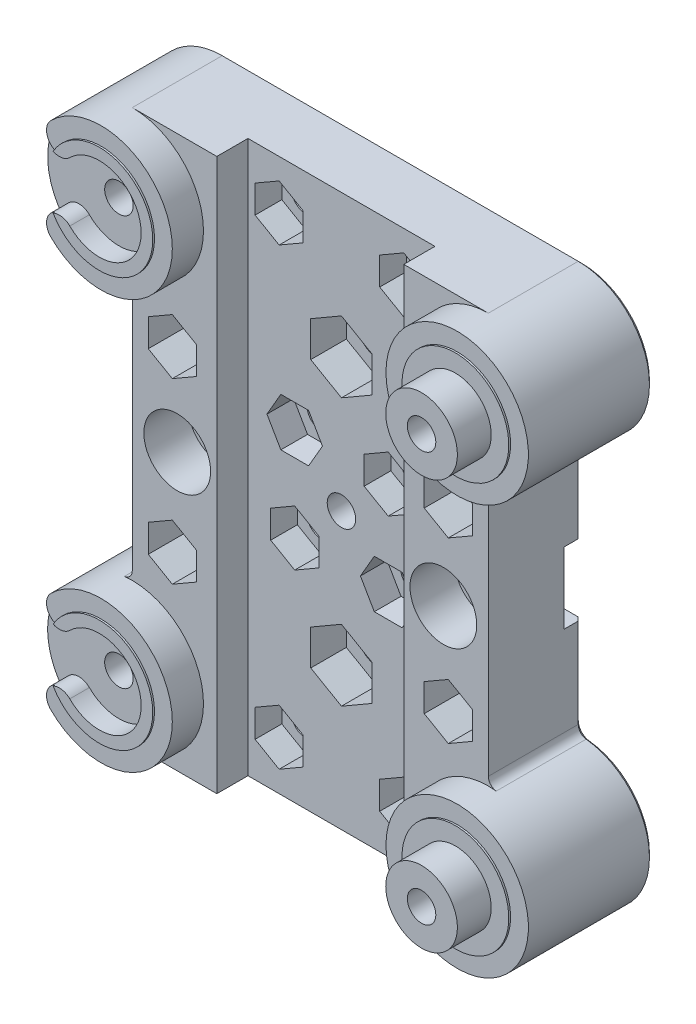
from build123d import *

# Parameters (mm, degrees)
SKETCH_2_W                  = 40
SKETCH_2_H                  = 62
EXTRUDE_1_DEPTH             = 10.5
EXTRUDE_2_DEPTH             = 10.5
CUT_EXTRUDE_1_DEPTH         = 5
SKETCH_29_R                 = 8
EXTRUDE_5_DEPTH             = 3.5
SKETCH_7_R                  = 4.025
EXTRUDE_3_DEPTH             = 9
SKETCH_8_R                  = 1.6
CUT_EXTRUDE_2_DEPTH         = 48.68647607
SKETCH_12_R                 = 6
SKETCH_12_R_2               = 4.025
EXTRUDE_4_DEPTH             = 0.2
SKETCH_13_R                 = 1.6
CUT_EXTRUDE_5_DEPTH         = 48.68647607
MIRROR_4_COPY_1_SKETCH_R    = 1.6
MIRROR_4_COPY_1_DEPTH       = 48.68647607
SKETCH_14_R                 = 2.05
CUT_EXTRUDE_6_DEPTH         = 48.68647607
SKETCH_15_R                 = 1.6
CUT_EXTRUDE_7_DEPTH         = 48.68647607
CUT_EXTRUDE_8_DEPTH         = 48.68647607
CUT_EXTRUDE_8_DEPTH_BACK    = 48.68647607
SKETCH_16_R                 = 1.6
PATTERN_CIRCULAR_1_COUNT    = 4
CUT_EXTRUDE_START           = -5
CUT_EXTRUDE_9_DEPTH         = 49.603325561
SKETCH_19_R                 = 3.75
CUT_EXTRUDE_11_DEPTH        = 5
SKETCH_18_W                 = 21
SKETCH_18_H                 = 62
CUT_EXTRUDE_10_DEPTH        = 3.5
MIRROR_7_COPY_1_SKETCH_R    = 1.6
MIRROR_7_COPY_1_DEPTH       = 48.68647607
MIRROR_7_COPY_2_SKETCH_R    = 1.6
MIRROR_7_COPY_2_DEPTH       = 48.68647607
MIRROR_7_COPY_3_SKETCH_R    = 1.6
MIRROR_7_COPY_3_DEPTH       = 48.68647607
MIRROR_7_COPY_4_SKETCH_R    = 2.05
MIRROR_7_COPY_4_DEPTH       = 48.68647607
MIRROR_7_COPY_5_DEPTH       = 10.5
MIRROR_7_COPY_6_DEPTH       = 5
MIRROR_7_COPY_7_SKETCH_R    = 8
MIRROR_7_COPY_7_DEPTH       = 3.5
MIRROR_7_COPY_8_SKETCH_R    = 4.025
MIRROR_7_COPY_8_DEPTH       = 9
MIRROR_7_COPY_9_SKETCH_R    = 1.6
MIRROR_7_COPY_9_DEPTH       = 48.68647607
MIRROR_7_COPY_10_SKETCH_R   = 6
MIRROR_7_COPY_10_SKETCH_R_2 = 4.025
MIRROR_7_COPY_10_DEPTH      = 0.2
MIRROR_START                = -5
MIRROR_7_COPY_11_DEPTH      = 49.603325561
CUT_EXTRUDE_12_DEPTH        = 3
PATTERN_CIRCULAR_2_COUNT    = 4
CUT_EXTRUDE_13_DEPTH        = 3
SKETCH_22_R                 = 1.6
CUT_EXTRUDE_14_DEPTH        = 46.891175622
SKETCH_23_R                 = 2.1
CUT_EXTRUDE_15_DEPTH        = 45.732538493
CUT_EXTRUDE_16_DEPTH        = 4
MIRROR_9_COPY_1_DEPTH       = 3
MIRROR_9_COPY_2_SKETCH_R    = 1.6
MIRROR_9_COPY_2_DEPTH       = 46.891175622
SKETCH_25_R                 = 4.025
CUT_EXTRUDE_17_DEPTH        = 5
SKETCH_26_R                 = 4.7
CUT_EXTRUDE_18_DEPTH        = 11
CUT_EXTRUDE_19_DEPTH        = 44.462627624
FILLET_1_R                  = 1
SKETCH_31_W                 = 3.2
SKETCH_31_H                 = 1.2
EXTRUDE_6_DEPTH             = 0.2
EXTRUDE_7_DEPTH             = 0.4
MIRROR_15_COPY_1_SKETCH_W   = 3.2
MIRROR_15_COPY_1_SKETCH_H   = 1.2
MIRROR_15_COPY_1_DEPTH      = 0.2
MIRROR_15_COPY_2_DEPTH      = 0.4
CUT_EXTRUDE_22_DEPTH        = 4
CHAMFER_1_SIZE              = 0.4
CHAMFER_2_SIZE              = 0.4
CHAMFER_3_SIZE              = 0.4
SKETCH_33_W                 = 3.25
SKETCH_33_H                 = 1
CUT_EXTRUDE_23_DEPTH        = 1
PATTERN_LINEAR_1_COUNT      = 5
PATTERN_LINEAR_1_PITCH      = 2
MIRROR_17_COPY_1_SKETCH_W   = 3.25
MIRROR_17_COPY_1_SKETCH_H   = 1
MIRROR_17_COPY_1_DEPTH      = 1
MIRROR_17_COPY_2_SKETCH_W   = 3.25
MIRROR_17_COPY_2_SKETCH_H   = 1
MIRROR_17_COPY_2_DEPTH      = 1
MIRROR_17_COPY_3_SKETCH_W   = 3.25
MIRROR_17_COPY_3_SKETCH_H   = 1
MIRROR_17_COPY_3_DEPTH      = 1
MIRROR_17_COPY_4_SKETCH_W   = 3.25
MIRROR_17_COPY_4_SKETCH_H   = 1
MIRROR_17_COPY_4_DEPTH      = 1


with BuildPart() as part:
    # 草图2 → 凸台-拉伸1 (new body)
    with BuildSketch(Plane.XY):
        Rectangle(SKETCH_2_W, SKETCH_2_H)
    extrude(amount=EXTRUDE_1_DEPTH)

    # 草图3 → 凸台-拉伸2 (add)
    with BuildSketch(Plane(origin=(0, 0, 0), x_dir=(-1, 0, 0), z_dir=(0, 0, -1))):
        with BuildLine():
            Line((20, 31), (20, 15))
            ThreePointArc((20, 15), (28, 23), (20, 31))
        make_face()
    extrude_2 = extrude(amount=-EXTRUDE_2_DEPTH)

    # 草图5 → 切除-拉伸1 (cut)
    with BuildSketch(Plane(origin=(0, 0, 0), x_dir=(-1, 0, 0), z_dir=(0, 0, -1))):
        Polygon((21.616580754, 25.8), (18.383419246, 25.8), (16.766838493, 23), (18.383419246, 20.2), (21.616580754, 20.2), (23.233161507, 23), align=None)
    cut_extrude_1 = extrude(amount=-CUT_EXTRUDE_1_DEPTH, mode=Mode.SUBTRACT)

    # 草图29 → 凸台-拉伸5 (add)
    with BuildSketch(Plane.XY.offset(10.5)):
        with Locations(Location((-20, 23, 0), (0, 0, 270))):
            Circle(SKETCH_29_R)
    extrude_5 = extrude(amount=EXTRUDE_5_DEPTH)

    # 草图7 → 凸台-拉伸3 (add)
    with BuildSketch(Plane.XY.offset(14)):
        with Locations((-20, 23)):
            Circle(SKETCH_7_R)
    extrude_3 = extrude(amount=EXTRUDE_3_DEPTH)

    # 草图8 → 切除-拉伸2 (cut, through all)
    with BuildSketch(Plane.XY.offset(23)):
        with Locations((-20, 23)):
            Circle(SKETCH_8_R)
    cut_extrude_2 = extrude(amount=-CUT_EXTRUDE_2_DEPTH, mode=Mode.SUBTRACT)

    # 草图12 → 凸台-拉伸4 (add)
    with BuildSketch(Plane.XY.offset(14)):
        with Locations((-20, 23)):
            Circle(SKETCH_12_R)
        with Locations((-20, 23)):
            Circle(SKETCH_12_R_2, mode=Mode.SUBTRACT)
    extrude_4 = extrude(amount=EXTRUDE_4_DEPTH)

    # 草图13 → 切除-拉伸5 (cut, symmetric)
    with BuildSketch(Plane(origin=(0, 0, 0), x_dir=(-1, 0, 0), z_dir=(0, 0, -1))):
        with Locations((-15.5, -10)):
            Circle(SKETCH_13_R)
    cut_extrude_5 = extrude(amount=CUT_EXTRUDE_5_DEPTH, both=True, mode=Mode.SUBTRACT)

    # 镜向3: 切除-拉伸5 across plane
    add(cut_extrude_5.mirror(Plane.ZX), mode=Mode.SUBTRACT)

    # 镜向4: 切除-拉伸5 across plane
    add(cut_extrude_5.mirror(Plane(origin=(0, 0, 0), x_dir=(0, 0, 1), z_dir=(1, 0, 0))), mode=Mode.SUBTRACT)

    # 镜向4 copy 1 sketch → 镜向4 copy 1 (cut, symmetric)
    with BuildSketch(Plane(origin=(0, 0, 0), x_dir=(1, 0, 0), z_dir=(0, 0, -1))):
        with Locations((-15.5, -10)):
            Circle(MIRROR_4_COPY_1_SKETCH_R)
    extrude(amount=MIRROR_4_COPY_1_DEPTH, both=True, mode=Mode.SUBTRACT)

    # 草图14 → 切除-拉伸6 (cut, symmetric)
    with BuildSketch(Plane(origin=(0, 0, 0), x_dir=(-1, 0, 0), z_dir=(0, 0, -1))):
        with Locations((14.95, 0)):
            Circle(SKETCH_14_R)
    cut_extrude_6 = extrude(amount=CUT_EXTRUDE_6_DEPTH, both=True, mode=Mode.SUBTRACT)

    # 草图15 → 切除-拉伸7 (cut, symmetric)
    with BuildSketch(Plane(origin=(0, 0, 0), x_dir=(-1, 0, 0), z_dir=(0, 0, -1))):
        with Locations((5.25, 5.25)):
            Circle(SKETCH_15_R)
    cut_extrude_7 = extrude(amount=CUT_EXTRUDE_7_DEPTH, both=True, mode=Mode.SUBTRACT)

    # 草图16 → 切除-拉伸8 (cut, two sides: drawn at the far end of the back side and taken through both)
    with BuildSketch(Plane(origin=(0, 0, 0), x_dir=(-1, 0, 0), z_dir=(0, 0, -1)).offset(-CUT_EXTRUDE_8_DEPTH_BACK)):
        Circle(SKETCH_16_R)
    extrude(amount=CUT_EXTRUDE_8_DEPTH + CUT_EXTRUDE_8_DEPTH_BACK, mode=Mode.SUBTRACT)

    # 阵列(圆周)1: 切除-拉伸7 ×4 about axis
    pattern_circular_1_axis = Axis((0, 0, 0), (0, 0, 1))
    for i in range(1, PATTERN_CIRCULAR_1_COUNT):
        add(cut_extrude_7.rotate(pattern_circular_1_axis, i * 360 / PATTERN_CIRCULAR_1_COUNT), mode=Mode.SUBTRACT)

    # 镜向5: 切除-拉伸6 across plane
    add(cut_extrude_6.mirror(Plane(origin=(0, 0, 0), x_dir=(0, 0, 1), z_dir=(1, 0, 0))), mode=Mode.SUBTRACT)

    # 草图17 → 切除-拉伸9 (cut)
    with BuildSketch(Plane.XY.offset(10.5).offset(CUT_EXTRUDE_START)):
        Polygon((-12.8, 11.558845727), (-15.5, 13.117691454), (-18.2, 11.558845727), (-18.2, 8.441154273), (-15.5, 6.882308546), (-12.8, 8.441154273), align=None)
    cut_extrude_9 = extrude(amount=CUT_EXTRUDE_9_DEPTH, mode=Mode.SUBTRACT)

    # 草图19 → 切除-拉伸11 (cut)
    with BuildSketch(Plane.XY.offset(10.5)):
        with Locations((-14.95, 0)):
            Circle(SKETCH_19_R)
    cut_extrude_11 = extrude(amount=-CUT_EXTRUDE_11_DEPTH, mode=Mode.SUBTRACT)

    # 镜向6: 凸台-拉伸2, 切除-拉伸1, 凸台-拉伸5, 凸台-拉伸3, 切除-拉伸2, 凸台-拉伸4, 切除-拉伸9 across plane
    add(extrude_2.mirror(Plane.ZX))
    add(cut_extrude_1.mirror(Plane.ZX), mode=Mode.SUBTRACT)
    add(extrude_5.mirror(Plane.ZX))
    add(extrude_3.mirror(Plane.ZX))
    add(cut_extrude_2.mirror(Plane.ZX), mode=Mode.SUBTRACT)
    add(extrude_4.mirror(Plane.ZX))
    add(cut_extrude_9.mirror(Plane.ZX), mode=Mode.SUBTRACT)

    # 草图18 → 切除-拉伸10 (cut)
    with BuildSketch(Plane.XY.offset(10.5)):
        Rectangle(SKETCH_18_W, SKETCH_18_H)
    extrude(amount=-CUT_EXTRUDE_10_DEPTH, mode=Mode.SUBTRACT)

    # 镜向7: 凸台-拉伸2, 切除-拉伸1, 凸台-拉伸5, 凸台-拉伸3, 切除-拉伸2, 凸台-拉伸4, 切除-拉伸5, 切除-拉伸6, 切除-拉伸9, 切除-拉伸11 across plane
    add(extrude_2.mirror(Plane(origin=(0, 0, 0), x_dir=(0, 0, 1), z_dir=(1, 0, 0))))
    add(cut_extrude_1.mirror(Plane(origin=(0, 0, 0), x_dir=(0, 0, 1), z_dir=(1, 0, 0))), mode=Mode.SUBTRACT)
    add(extrude_5.mirror(Plane(origin=(0, 0, 0), x_dir=(0, 0, 1), z_dir=(1, 0, 0))))
    add(extrude_3.mirror(Plane(origin=(0, 0, 0), x_dir=(0, 0, 1), z_dir=(1, 0, 0))))
    add(cut_extrude_2.mirror(Plane(origin=(0, 0, 0), x_dir=(0, 0, 1), z_dir=(1, 0, 0))), mode=Mode.SUBTRACT)
    add(extrude_4.mirror(Plane(origin=(0, 0, 0), x_dir=(0, 0, 1), z_dir=(1, 0, 0))))
    add(cut_extrude_5.mirror(Plane(origin=(0, 0, 0), x_dir=(0, 0, 1), z_dir=(1, 0, 0))), mode=Mode.SUBTRACT)
    add(cut_extrude_6.mirror(Plane(origin=(0, 0, 0), x_dir=(0, 0, 1), z_dir=(1, 0, 0))), mode=Mode.SUBTRACT)
    add(cut_extrude_9.mirror(Plane(origin=(0, 0, 0), x_dir=(0, 0, 1), z_dir=(1, 0, 0))), mode=Mode.SUBTRACT)
    add(cut_extrude_11.mirror(Plane(origin=(0, 0, 0), x_dir=(0, 0, 1), z_dir=(1, 0, 0))), mode=Mode.SUBTRACT)

    # 镜向7 copy 1 sketch → 镜向7 copy 1 (cut, symmetric)
    with BuildSketch(Plane(origin=(0, 0, 0), x_dir=(1, 0, 0), z_dir=(0, 0, -1))):
        with Locations((-15.5, -10)):
            Circle(MIRROR_7_COPY_1_SKETCH_R)
    extrude(amount=MIRROR_7_COPY_1_DEPTH, both=True, mode=Mode.SUBTRACT)

    # 镜向7 copy 2 sketch → 镜向7 copy 2 (cut, symmetric)
    with BuildSketch(Plane(origin=(0, 0, 0), x_dir=(-1, 0, 0), z_dir=(0, 0, -1))):
        with Locations((-15.5, -10)):
            Circle(MIRROR_7_COPY_2_SKETCH_R)
    extrude(amount=MIRROR_7_COPY_2_DEPTH, both=True, mode=Mode.SUBTRACT)

    # 镜向7 copy 3 sketch → 镜向7 copy 3 (cut, symmetric)
    with BuildSketch(Plane(origin=(0, 0, 0), x_dir=(-1, 0, 0), z_dir=(0, 0, -1))):
        with Locations((-15.5, 10)):
            Circle(MIRROR_7_COPY_3_SKETCH_R)
    extrude(amount=MIRROR_7_COPY_3_DEPTH, both=True, mode=Mode.SUBTRACT)

    # 镜向7 copy 4 sketch → 镜向7 copy 4 (cut, symmetric)
    with BuildSketch(Plane(origin=(0, 0, 0), x_dir=(-1, 0, 0), z_dir=(0, 0, -1))):
        with Locations((14.95, 0)):
            Circle(MIRROR_7_COPY_4_SKETCH_R)
    extrude(amount=MIRROR_7_COPY_4_DEPTH, both=True, mode=Mode.SUBTRACT)

    # 镜向7 copy 5 sketch → 镜向7 copy 5 (add)
    with BuildSketch(Plane(origin=(0, 0, 0), x_dir=(1, 0, 0), z_dir=(0, 0, -1))):
        with BuildLine():
            Line((20, 31), (20, 15))
            ThreePointArc((20, 15), (28, 23), (20, 31))
        make_face()
    extrude(amount=-MIRROR_7_COPY_5_DEPTH)

    # 镜向7 copy 6 sketch → 镜向7 copy 6 (cut)
    with BuildSketch(Plane(origin=(0, 0, 0), x_dir=(1, 0, 0), z_dir=(0, 0, -1))):
        Polygon((21.616580754, 25.8), (18.383419246, 25.8), (16.766838493, 23), (18.383419246, 20.2), (21.616580754, 20.2), (23.233161507, 23), align=None)
    extrude(amount=-MIRROR_7_COPY_6_DEPTH, mode=Mode.SUBTRACT)

    # 镜向7 copy 7 sketch → 镜向7 copy 7 (add)
    with BuildSketch(Plane(origin=(0, 0, 10.5), x_dir=(-1, 0, 0), z_dir=(0, 0, 1))):
        with Locations(Location((-20, 23, 0), (0, 0, 270))):
            Circle(MIRROR_7_COPY_7_SKETCH_R)
    extrude(amount=MIRROR_7_COPY_7_DEPTH)

    # 镜向7 copy 8 sketch → 镜向7 copy 8 (add)
    with BuildSketch(Plane(origin=(0, 0, 14), x_dir=(-1, 0, 0), z_dir=(0, 0, 1))):
        with Locations((-20, 23)):
            Circle(MIRROR_7_COPY_8_SKETCH_R)
    extrude(amount=MIRROR_7_COPY_8_DEPTH)

    # 镜向7 copy 9 sketch → 镜向7 copy 9 (cut, through all)
    with BuildSketch(Plane(origin=(0, 0, 23), x_dir=(-1, 0, 0), z_dir=(0, 0, 1))):
        with Locations((-20, 23)):
            Circle(MIRROR_7_COPY_9_SKETCH_R)
    extrude(amount=-MIRROR_7_COPY_9_DEPTH, mode=Mode.SUBTRACT)

    # 镜向7 copy 10 sketch → 镜向7 copy 10 (add)
    with BuildSketch(Plane(origin=(0, 0, 14), x_dir=(-1, 0, 0), z_dir=(0, 0, 1))):
        with Locations((-20, 23)):
            Circle(MIRROR_7_COPY_10_SKETCH_R)
        with Locations((-20, 23)):
            Circle(MIRROR_7_COPY_10_SKETCH_R_2, mode=Mode.SUBTRACT)
    extrude(amount=MIRROR_7_COPY_10_DEPTH)

    # 镜向7 copy 11 sketch → 镜向7 copy 11 (cut)
    with BuildSketch(Plane(origin=(0, 0, 10.5), x_dir=(-1, 0, 0), z_dir=(0, 0, 1)).offset(MIRROR_START)):
        Polygon((-12.8, 11.558845727), (-15.5, 13.117691454), (-18.2, 11.558845727), (-18.2, 8.441154273), (-15.5, 6.882308546), (-12.8, 8.441154273), align=None)
    extrude(amount=MIRROR_7_COPY_11_DEPTH, mode=Mode.SUBTRACT)

    # 草图20 → 切除-拉伸12 (cut)
    with BuildSketch(Plane.XY.offset(7)):
        Polygon((-3.691154273, 7.95), (-6.808845727, 7.95), (-8.367691454, 5.25), (-6.808845727, 2.55), (-3.691154273, 2.55), (-2.132308546, 5.25), align=None)
    cut_extrude_12 = extrude(amount=-CUT_EXTRUDE_12_DEPTH, mode=Mode.SUBTRACT)

    # 阵列(圆周)2: 切除-拉伸12 ×4 about axis
    pattern_circular_2_axis = Axis((0, 0, 0), (0, 0, 1))
    for i in range(1, PATTERN_CIRCULAR_2_COUNT):
        add(cut_extrude_12.rotate(pattern_circular_2_axis, i * 360 / PATTERN_CIRCULAR_2_COUNT), mode=Mode.SUBTRACT)

    # 草图21 → 切除-拉伸13 (cut)
    with BuildSketch(Plane.XY.offset(7)):
        Polygon((-4.3, 27.058845727), (-7, 28.617691454), (-9.7, 27.058845727), (-9.7, 23.941154273), (-7, 22.382308546), (-4.3, 23.941154273), align=None)
    cut_extrude_13 = extrude(amount=-CUT_EXTRUDE_13_DEPTH, mode=Mode.SUBTRACT)

    # 草图22 → 切除-拉伸14 (cut, through all)
    with BuildSketch(Plane.XY.offset(4)):
        with Locations((-7, 25.5)):
            Circle(SKETCH_22_R)
    cut_extrude_14 = extrude(amount=-CUT_EXTRUDE_14_DEPTH, mode=Mode.SUBTRACT)

    # 镜向8: 切除-拉伸13, 切除-拉伸14 across plane
    add(cut_extrude_13.mirror(Plane(origin=(0, 0, 0), x_dir=(0, 0, 1), z_dir=(1, 0, 0))), mode=Mode.SUBTRACT)
    add(cut_extrude_14.mirror(Plane(origin=(0, 0, 0), x_dir=(0, 0, 1), z_dir=(1, 0, 0))), mode=Mode.SUBTRACT)

    # 草图23 → 切除-拉伸15 (cut, through all)
    with BuildSketch(Plane.XY.offset(7)):
        with Locations((0, 15)):
            Circle(SKETCH_23_R)
    cut_extrude_15 = extrude(amount=-CUT_EXTRUDE_15_DEPTH, mode=Mode.SUBTRACT)

    # 草图24 → 切除-拉伸16 (cut)
    with BuildSketch(Plane.XY.offset(7)):
        Polygon((0, 18.983716857), (-3.45, 16.991858429), (-3.45, 13.008141571), (0, 11.016283143), (3.45, 13.008141571), (3.45, 16.991858429), align=None)
    cut_extrude_16 = extrude(amount=-CUT_EXTRUDE_16_DEPTH, mode=Mode.SUBTRACT)

    # 镜向9: 切除-拉伸13, 切除-拉伸14, 切除-拉伸15, 切除-拉伸16 across plane
    add(cut_extrude_13.mirror(Plane.ZX), mode=Mode.SUBTRACT)
    add(cut_extrude_14.mirror(Plane.ZX), mode=Mode.SUBTRACT)
    add(cut_extrude_15.mirror(Plane.ZX), mode=Mode.SUBTRACT)
    add(cut_extrude_16.mirror(Plane.ZX), mode=Mode.SUBTRACT)

    # 镜向9 copy 1 sketch → 镜向9 copy 1 (cut)
    with BuildSketch(Plane(origin=(0, 0, 7), x_dir=(-1, 0, 0), z_dir=(0, 0, 1))):
        Polygon((-4.3, 27.058845727), (-7, 28.617691454), (-9.7, 27.058845727), (-9.7, 23.941154273), (-7, 22.382308546), (-4.3, 23.941154273), align=None)
    extrude(amount=-MIRROR_9_COPY_1_DEPTH, mode=Mode.SUBTRACT)

    # 镜向9 copy 2 sketch → 镜向9 copy 2 (cut, through all)
    with BuildSketch(Plane(origin=(0, 0, 4), x_dir=(-1, 0, 0), z_dir=(0, 0, 1))):
        with Locations((-7, 25.5)):
            Circle(MIRROR_9_COPY_2_SKETCH_R)
    extrude(amount=-MIRROR_9_COPY_2_DEPTH, mode=Mode.SUBTRACT)

    # 草图25 → 切除-拉伸17 (cut)
    with BuildSketch(Plane.XY.offset(23).offset(CUT_EXTRUDE_START)):
        with Locations((20, 23)):
            Circle(SKETCH_25_R)
        with Locations(Location((20, -23, 0), (0, 0, 180))):
            Circle(SKETCH_25_R)
    extrude(amount=CUT_EXTRUDE_17_DEPTH, mode=Mode.SUBTRACT)

    # 草图26 → 切除-拉伸18 (cut)
    with BuildSketch(Plane.XY.offset(23)):
        with Locations((-20, 23)):
            Circle(SKETCH_26_R)
    cut_extrude_18 = extrude(amount=-CUT_EXTRUDE_18_DEPTH, mode=Mode.SUBTRACT)

    # 草图27 → 切除-拉伸19 (cut, through all)
    with BuildSketch(Plane.XY.offset(12)):
        with BuildLine():
            ThreePointArc((-25.644389756, 28.669291339), (-25.649525707, 26.335844613), (-23.316078982, 26.330708661))
            ThreePointArc((-23.316078982, 26.330708661), (-24.7, 23), (-23.316078982, 19.669291339))
            ThreePointArc((-23.316078982, 19.669291339), (-25.649525707, 19.664155387), (-25.644389756, 17.330708661))
            ThreePointArc((-25.644389756, 17.330708661), (-28, 23), (-25.644389756, 28.669291339))
        make_face()
    cut_extrude_19 = extrude(amount=CUT_EXTRUDE_19_DEPTH, mode=Mode.SUBTRACT)

    # 镜向12: 切除-拉伸18, 切除-拉伸19 across plane
    add(cut_extrude_18.mirror(Plane.ZX), mode=Mode.SUBTRACT)
    add(cut_extrude_19.mirror(Plane.ZX), mode=Mode.SUBTRACT)

    # 圆角1
    # the kernel refuses this fillet: 1 mm, written as the material it adds along each edge
    with BuildSketch(Plane(origin=(-20, 15, 0), x_dir=(0, -1, 0), z_dir=(0, 0, 1))) as fillet_1_piece_1:
        with BuildLine():
            CenterArc((0.94427191, -1), FILLET_1_R, 90, 83.620629792)
            ThreePointArc((-0.04953608, -0.888888889), (-0.01239362, -0.445134047), (0, 0))
            Line((0, 0), (0.94427191, 0))
        make_face()
    extrude(amount=10.5)
    with BuildSketch(Plane(origin=(-20, -15, 0), x_dir=(-0.9984507974857615, -0.0556417559036993, 0), z_dir=(0, 0, 1))) as fillet_1_piece_2:
        with BuildLine():
            CenterArc((0.94590985, -0.998450797), FILLET_1_R, 93.189685104, 83.620629792)
            Line((-0.052540947, -0.942809042), (0, 0))
            ThreePointArc((0, 0), (0.445134047, -0.01239362), (0.890268094, 0))
        make_face()
    extrude(amount=10.5)
    with BuildSketch(Plane(origin=(20, 15, 0), x_dir=(0, -1, 0), z_dir=(0, 0, 1))) as fillet_1_piece_3:
        with BuildLine():
            CenterArc((0.94427191, 1), FILLET_1_R, 186.379370208, 83.620629792)
            ThreePointArc((-0.04953608, 0.888888889), (-0.01239362, 0.445134047), (0, 0))
            Line((0, 0), (0.94427191, 0))
        make_face()
    extrude(amount=10.5)
    with BuildSketch(Plane(origin=(20, -15, 0), x_dir=(0.9984507974857615, -0.055641755903699075, 0), z_dir=(0, 0, 1))) as fillet_1_piece_4:
        with BuildLine():
            CenterArc((0.94590985, 0.998450797), FILLET_1_R, 183.189685104, 83.620629792)
            Line((-0.052540947, 0.942809042), (0, 0))
            ThreePointArc((0, 0), (0.445134047, 0.01239362), (0.890268094, 0))
        make_face()
    extrude(amount=10.5)

    # 草图31 → 凸台-拉伸6 (add)
    with BuildSketch(Plane(origin=(0, 0, 5), x_dir=(-1, 0, 0), z_dir=(0, 0, -1))):
        with Locations((-20, 25.2)):
            Rectangle(SKETCH_31_W, SKETCH_31_H)
        Polygon((-21.6, 24.6), (-21.6, 25.8), (-21.616580754, 25.8), (-22.309401077, 24.6), align=None)
        Polygon((-18.383419246, 25.8), (-18.4, 25.8), (-18.4, 24.6), (-17.690598923, 24.6), align=None)
        Polygon((-17.690598923, 21.4), (-18.4, 21.4), (-18.4, 20.2), (-18.383419246, 20.2), align=None)
        with Locations((-20, 20.8)):
            Rectangle(SKETCH_31_W, SKETCH_31_H)
        Polygon((-21.6, 20.2), (-21.6, 21.4), (-22.309401077, 21.4), (-21.616580754, 20.2), align=None)
    extrude_6 = extrude(amount=EXTRUDE_6_DEPTH)

    # 草图31<3> → 凸台-拉伸7 (add)
    with BuildSketch(Plane(origin=(0, 0, 5), x_dir=(-1, 0, 0), z_dir=(0, 0, -1))):
        Polygon((-21.6, 24.6), (-21.6, 25.8), (-21.616580754, 25.8), (-22.309401077, 24.6), align=None)
        Polygon((-21.6, 21.4), (-21.6, 24.6), (-22.309401077, 24.6), (-23.233161507, 23), (-22.309401077, 21.4), align=None)
        Polygon((-21.6, 20.2), (-21.6, 21.4), (-22.309401077, 21.4), (-21.616580754, 20.2), align=None)
        Polygon((-18.383419246, 25.8), (-18.4, 25.8), (-18.4, 24.6), (-17.690598923, 24.6), align=None)
        Polygon((-17.690598923, 24.6), (-18.4, 24.6), (-18.4, 21.4), (-17.690598923, 21.4), (-16.766838493, 23), align=None)
        Polygon((-17.690598923, 21.4), (-18.4, 21.4), (-18.4, 20.2), (-18.383419246, 20.2), align=None)
    extrude_7 = extrude(amount=EXTRUDE_7_DEPTH)

    # 镜向14: 凸台-拉伸6, 凸台-拉伸7 across plane
    add(extrude_6.mirror(Plane.ZX))
    add(extrude_7.mirror(Plane.ZX))

    # 镜向15: 凸台-拉伸6, 凸台-拉伸7 across plane
    add(extrude_6.mirror(Plane(origin=(0, 0, 0), x_dir=(0, 0, 1), z_dir=(1, 0, 0))))
    add(extrude_7.mirror(Plane(origin=(0, 0, 0), x_dir=(0, 0, 1), z_dir=(1, 0, 0))))

    # 镜向15 copy 1 sketch → 镜向15 copy 1 (add)
    with BuildSketch(Plane(origin=(0, 0, 5), x_dir=(1, 0, 0), z_dir=(0, 0, -1))):
        with Locations((-20, 25.2)):
            Rectangle(MIRROR_15_COPY_1_SKETCH_W, MIRROR_15_COPY_1_SKETCH_H)
        Polygon((-21.6, 24.6), (-21.6, 25.8), (-21.616580754, 25.8), (-22.309401077, 24.6), align=None)
        Polygon((-18.383419246, 25.8), (-18.4, 25.8), (-18.4, 24.6), (-17.690598923, 24.6), align=None)
        Polygon((-17.690598923, 21.4), (-18.4, 21.4), (-18.4, 20.2), (-18.383419246, 20.2), align=None)
        with Locations((-20, 20.8)):
            Rectangle(MIRROR_15_COPY_1_SKETCH_W, MIRROR_15_COPY_1_SKETCH_H)
        Polygon((-21.6, 20.2), (-21.6, 21.4), (-22.309401077, 21.4), (-21.616580754, 20.2), align=None)
    extrude(amount=MIRROR_15_COPY_1_DEPTH)

    # 镜向15 copy 2 sketch → 镜向15 copy 2 (add)
    with BuildSketch(Plane(origin=(0, 0, 5), x_dir=(1, 0, 0), z_dir=(0, 0, -1))):
        Polygon((-21.6, 24.6), (-21.6, 25.8), (-21.616580754, 25.8), (-22.309401077, 24.6), align=None)
        Polygon((-21.6, 21.4), (-21.6, 24.6), (-22.309401077, 24.6), (-23.233161507, 23), (-22.309401077, 21.4), align=None)
        Polygon((-21.6, 20.2), (-21.6, 21.4), (-22.309401077, 21.4), (-21.616580754, 20.2), align=None)
        Polygon((-18.383419246, 25.8), (-18.4, 25.8), (-18.4, 24.6), (-17.690598923, 24.6), align=None)
        Polygon((-17.690598923, 24.6), (-18.4, 24.6), (-18.4, 21.4), (-17.690598923, 21.4), (-16.766838493, 23), align=None)
        Polygon((-17.690598923, 21.4), (-18.4, 21.4), (-18.4, 20.2), (-18.383419246, 20.2), align=None)
    extrude(amount=MIRROR_15_COPY_2_DEPTH)

    # 草图32 → 切除-拉伸22 (cut, symmetric)
    with BuildSketch(Plane(origin=(0, 0, 0), x_dir=(1, 0, 0), z_dir=(0, 1, 0))):
        Polygon((18, 0), (20, -2), (20, 0), align=None)
    cut_extrude_22 = extrude(amount=CUT_EXTRUDE_22_DEPTH, both=True, mode=Mode.SUBTRACT)

    # 镜向16: 切除-拉伸22 across plane
    add(cut_extrude_22.mirror(Plane(origin=(0, 0, 0), x_dir=(0, 0, 1), z_dir=(1, 0, 0))), mode=Mode.SUBTRACT)

    # 倒角1
    chamfer_1_edges = [part.edges().sort_by_distance(p)[0] for p in [
        (20, 9.027864045, 0),
        (-20, -9.027864045, 0),
        (0, -31, 0),
        (0, 31, 0),
        (-27.98760638, -23.445134047, 0),
        (-20, 9.027864045, 0),
        (-27.98760638, 23.445134047, 0),
        (20, -9.027864045, 0),
        (27.98760638, -23.445134047, 0),
        (27.98760638, 23.445134047, 0),
        (-20.254644008, -14.722394757, 0),
        (-20.254644008, 14.722394757, 0),
        (20.254644008, -14.722394757, 0),
        (20.254644008, 14.722394757, 0),
    ]]
    chamfer(chamfer_1_edges, length=CHAMFER_1_SIZE)

    # 倒角2
    chamfer_2_edges = [part.edges().sort_by_distance(p)[0] for p in [
        (-3.65, 5.25, 0),
        (1.6, 0, 0),
        (-5.25, -3.65, 0),
        (3.65, -5.25, 0),
        (5.25, 3.65, 0),
        (12.9, 0, 0),
        (-8.6, 25.5, 0),
        (8.6, 25.5, 0),
        (-2.1, 15, 0),
        (-8.6, -25.5, 0),
        (8.6, -25.5, 0),
        (-2.1, -15, 0),
        (17.1, -10, 0),
        (17.1, 10, 0),
        (-17.1, -10, 0),
        (-17.1, 10, 0),
        (-12.9, 0, 0),
    ]]
    chamfer(chamfer_2_edges, length=CHAMFER_2_SIZE)

    # 倒角3
    chamfer_3_edges = [part.edges().sort_by_distance(p)[0] for p in [
        (-22.424871131, -24.4, 0),
        (-20, -25.8, 0),
        (-17.575128869, -24.4, 0),
        (-17.575128869, -21.6, 0),
        (-20, -20.2, 0),
        (-22.424871131, -21.6, 0),
        (-22.424871131, 24.4, 0),
        (-20, 25.8, 0),
        (22.424871131, 24.4, 0),
        (-17.575128869, 24.4, 0),
        (20, 25.8, 0),
        (17.575128869, 24.4, 0),
        (17.575128869, 21.6, 0),
        (20, 20.2, 0),
        (22.424871131, 21.6, 0),
        (-17.575128869, 21.6, 0),
        (-20, 20.2, 0),
        (-22.424871131, 21.6, 0),
        (22.424871131, -24.4, 0),
        (20, -25.8, 0),
        (17.575128869, -24.4, 0),
        (17.575128869, -21.6, 0),
        (20, -20.2, 0),
        (22.424871131, -21.6, 0),
    ]]
    chamfer(chamfer_3_edges, length=CHAMFER_3_SIZE)

    # 草图33 → 切除-拉伸23 (cut)
    with BuildSketch(Plane(origin=(0, 0, 0), x_dir=(-1, 0, 0), z_dir=(0, 0, -1))):
        with Locations((-1.625, 29.5)):
            Rectangle(SKETCH_33_W, SKETCH_33_H)
        with Locations((1.625, 29.5)):
            Rectangle(SKETCH_33_W, SKETCH_33_H)
    cut_extrude_23 = extrude(amount=-CUT_EXTRUDE_23_DEPTH, mode=Mode.SUBTRACT)

    # 阵列(线性)1: 切除-拉伸23 ×5
    with Locations(*[(0, -i * PATTERN_LINEAR_1_PITCH, 0) for i in range(1, PATTERN_LINEAR_1_COUNT)]):
        add(cut_extrude_23, mode=Mode.SUBTRACT)

    # 镜向17: 切除-拉伸23 across plane
    add(cut_extrude_23.mirror(Plane.ZX), mode=Mode.SUBTRACT)

    # 镜向17 copy 1 sketch → 镜向17 copy 1 (cut)
    with BuildSketch(Plane(origin=(0, 2, 0), x_dir=(-1, 0, 0), z_dir=(0, 0, -1))):
        with Locations((-1.625, -29.5)):
            Rectangle(MIRROR_17_COPY_1_SKETCH_W, MIRROR_17_COPY_1_SKETCH_H)
        with Locations((1.625, -29.5)):
            Rectangle(MIRROR_17_COPY_1_SKETCH_W, MIRROR_17_COPY_1_SKETCH_H)
    extrude(amount=-MIRROR_17_COPY_1_DEPTH, mode=Mode.SUBTRACT)

    # 镜向17 copy 2 sketch → 镜向17 copy 2 (cut)
    with BuildSketch(Plane(origin=(0, 4, 0), x_dir=(-1, 0, 0), z_dir=(0, 0, -1))):
        with Locations((-1.625, -29.5)):
            Rectangle(MIRROR_17_COPY_2_SKETCH_W, MIRROR_17_COPY_2_SKETCH_H)
        with Locations((1.625, -29.5)):
            Rectangle(MIRROR_17_COPY_2_SKETCH_W, MIRROR_17_COPY_2_SKETCH_H)
    extrude(amount=-MIRROR_17_COPY_2_DEPTH, mode=Mode.SUBTRACT)

    # 镜向17 copy 3 sketch → 镜向17 copy 3 (cut)
    with BuildSketch(Plane(origin=(0, 6, 0), x_dir=(-1, 0, 0), z_dir=(0, 0, -1))):
        with Locations((-1.625, -29.5)):
            Rectangle(MIRROR_17_COPY_3_SKETCH_W, MIRROR_17_COPY_3_SKETCH_H)
        with Locations((1.625, -29.5)):
            Rectangle(MIRROR_17_COPY_3_SKETCH_W, MIRROR_17_COPY_3_SKETCH_H)
    extrude(amount=-MIRROR_17_COPY_3_DEPTH, mode=Mode.SUBTRACT)

    # 镜向17 copy 4 sketch → 镜向17 copy 4 (cut)
    with BuildSketch(Plane(origin=(0, 8, 0), x_dir=(-1, 0, 0), z_dir=(0, 0, -1))):
        with Locations((-1.625, -29.5)):
            Rectangle(MIRROR_17_COPY_4_SKETCH_W, MIRROR_17_COPY_4_SKETCH_H)
        with Locations((1.625, -29.5)):
            Rectangle(MIRROR_17_COPY_4_SKETCH_W, MIRROR_17_COPY_4_SKETCH_H)
    extrude(amount=-MIRROR_17_COPY_4_DEPTH, mode=Mode.SUBTRACT)


solid = part.part
